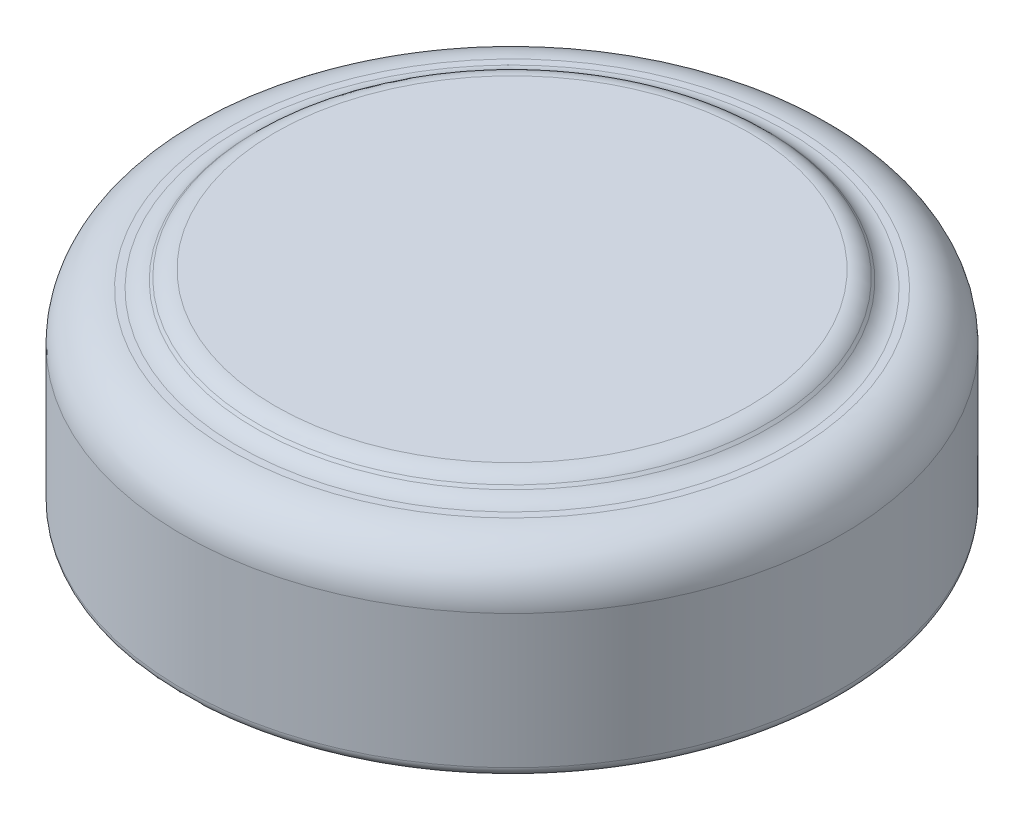
from build123d import *


with BuildPart() as part:
    # Sketch1 → Revolve1 (revolve)
    with BuildSketch(Plane.XY):
        with BuildLine():
            Line((0, 0), (-3.3, 0))
            ThreePointArc((-3.3, 0), (-3.370710678, 0.029289322), (-3.4, 0.1))
            Line((-3.4, 0.1), (-3.4, 1.478))
            ThreePointArc((-3.4, 1.478), (-3.253553391, 1.831553391), (-2.9, 1.978))
            Line((-2.9, 1.978), (-2.823553391, 1.978))
            ThreePointArc((-2.823553391, 1.978), (-2.727882533, 1.997030117), (-2.646776695, 2.051223305))
            Line((-2.646776695, 2.051223305), (-2.621223305, 2.076776695))
            ThreePointArc((-2.621223305, 2.076776695), (-2.540117467, 2.130969883), (-2.444446609, 2.15))
            Line((-2.444446609, 2.15), (0, 2.15))
            Line((0, 2.15), (0, 0))
        make_face()
    revolve(axis=Axis((0, 2.15, 0), (0, -1, 0)))


solid = part.part
